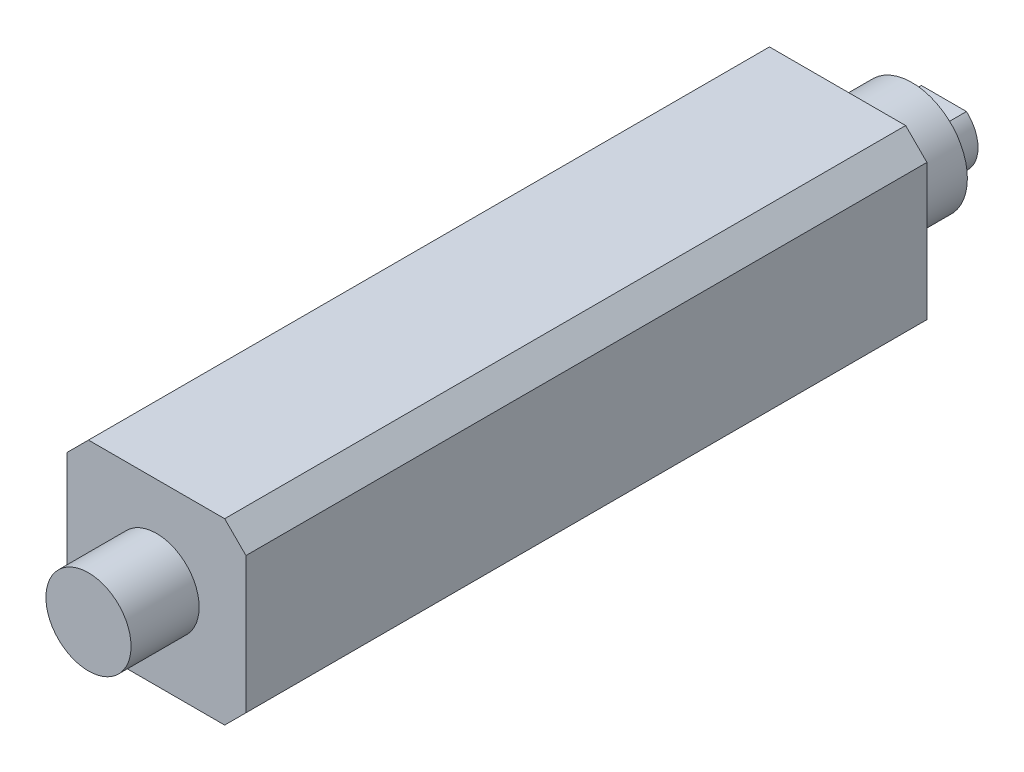
from build123d import *

# Parameters (mm, degrees)
EXTRUDE_1_DEPTH     = 160
SKETCH_2_R          = 15
EXTRUDE_2_DEPTH     = 3
SKETCH_3_R          = 13
EXTRUDE_3_DEPTH     = 14.5
SKETCH_4_R          = 8
EXTRUDE_4_DEPTH     = 7.5
SKETCH_5_R          = 10
EXTRUDE_5_DEPTH     = 16
CUT_EXTRUDE_START   = -5
CUT_EXTRUDE_1_DEPTH = 5
M10X1_25_1_D        = 8.8
M10X1_25_1_DEPTH    = 15
M10X1_25_1_TIP      = 2.643786724


with BuildPart() as part:
    # 스케치1 → 보스-돌출1 (new body)
    with BuildSketch(Plane.XY):
        Polygon((-21, 16), (-16, 21), (16, 21), (21, 16), (21, -16), (16, -21), (-16, -21), (-21, -16), align=None)
    extrude(amount=EXTRUDE_1_DEPTH)

    # 스케치2 → 보스-돌출2 (add)
    with BuildSketch(Plane.XY):
        Circle(SKETCH_2_R)
    extrude(amount=-EXTRUDE_2_DEPTH)

    # 스케치3 → 보스-돌출3 (add)
    with BuildSketch(Plane(origin=(0, 0, -3), x_dir=(-1, 0, 0), z_dir=(0, 0, -1))):
        Circle(SKETCH_3_R)
    extrude(amount=EXTRUDE_3_DEPTH)

    # 스케치4 → 보스-돌출4 (add)
    with BuildSketch(Plane(origin=(0, 0, -17.5), x_dir=(-1, 0, 0), z_dir=(0, 0, -1))):
        Circle(SKETCH_4_R)
    extrude(amount=EXTRUDE_4_DEPTH)

    # 스케치5 → 보스-돌출5 (add)
    with BuildSketch(Plane.XY.offset(160)):
        Circle(SKETCH_5_R)
    extrude(amount=EXTRUDE_5_DEPTH)

    # 스케치6 → 컷-돌출1 (cut)
    with BuildSketch(Plane(origin=(0, 0, -25), x_dir=(-1, 0, 0), z_dir=(0, 0, -1)).offset(CUT_EXTRUDE_START)):
        with BuildLine():
            Line((-5.291502622, 6), (5.291502622, 6))
            ThreePointArc((5.291502622, 6), (0, 8), (-5.291502622, 6))
        make_face()
        with BuildLine():
            Line((-5.291502622, -6), (5.291502622, -6))
            ThreePointArc((5.291502622, -6), (0, -8), (-5.291502622, -6))
        make_face()
    extrude(amount=CUT_EXTRUDE_1_DEPTH, mode=Mode.SUBTRACT)

    # M10x1.25 탭을 위한 탭 드릴1
    with Locations(Plane(origin=(0, 0, -25), x_dir=(-1, 0, 0), z_dir=(0, 0, -1))):
        with Locations((0, 0)):
            Hole(M10X1_25_1_D / 2, depth=M10X1_25_1_DEPTH)
            with Locations((0, 0, -(M10X1_25_1_DEPTH + M10X1_25_1_TIP / 2))):  # 118° drill point
                Cone(0, M10X1_25_1_D / 2, M10X1_25_1_TIP, mode=Mode.SUBTRACT)


solid = part.part
